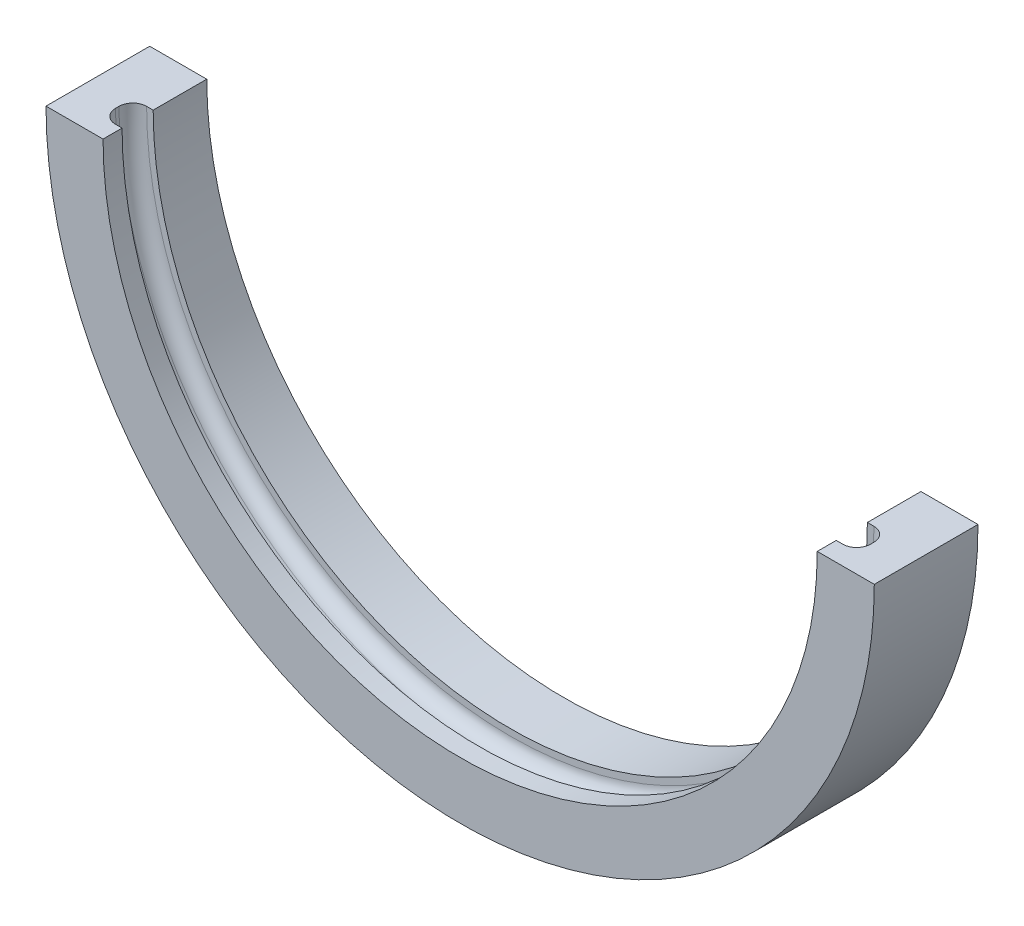
from build123d import *

# Parameters (mm, degrees)
BOSS_EXTRUDE1_DEPTH = 5.715
BOSS_EXTRUDE2_DEPTH = 3.4925
BOSS_EXTRUDE3_START = 9.8425
BOSS_EXTRUDE3_DEPTH = 9.8425
FILLET1_R           = 2.54
SKETCH5_R           = 1.524
CUT_EXTRUDE1_DEPTH  = 6.35


with BuildPart() as part:
    # Sketch1 → Boss-Extrude1 (new body)
    with BuildSketch(Plane.XY):
        with BuildLine():
            ThreePointArc((69.342, 76.073), (0, 6.731), (-69.342, 76.073))
            Line((-69.342, 76.073), (-76.073, 76.073))
            ThreePointArc((-76.073, 76.073), (0, 0), (76.073, 76.073))
            Line((76.073, 76.073), (69.342, 76.073))
        make_face()
    extrude(amount=BOSS_EXTRUDE1_DEPTH)

    # Sketch3 → Boss-Extrude2 (add)
    with BuildSketch(Plane.XY.offset(5.715)):
        with BuildLine():
            ThreePointArc((65.5955, 76.073), (0, 10.4775), (-65.5955, 76.073))
            Line((-65.5955, 76.073), (-76.073, 76.073))
            ThreePointArc((-76.073, 76.073), (0, 0), (76.073, 76.073))
            Line((76.073, 76.073), (65.5955, 76.073))
        make_face()
    extrude(amount=BOSS_EXTRUDE2_DEPTH)

    # Sketch4 → Boss-Extrude3 (add)
    with BuildSketch(Plane(origin=(0, 0, 0), x_dir=(-1, 0, 0), z_dir=(0, 0, -1)).offset(BOSS_EXTRUDE3_START)):
        with BuildLine():
            ThreePointArc((65.5955, 76.073), (0, 10.4775), (-65.5955, 76.073))
            Line((-65.5955, 76.073), (-76.073, 76.073))
            ThreePointArc((-76.073, 76.073), (0, 0), (76.073, 76.073))
            Line((76.073, 76.073), (65.5955, 76.073))
        make_face()
    extrude(amount=-BOSS_EXTRUDE3_DEPTH)

    # Fillet1
    fillet1_edges = [part.edges().sort_by_distance(p)[0] for p in [
        (0, 6.731, 5.715),
        (0, 6.731, 0),
    ]]
    fillet(fillet1_edges, radius=FILLET1_R)

    # Sketch5 → Cut-Extrude1 (cut)
    with BuildSketch(Plane(origin=(0, 0, 0), x_dir=(1, 0, 0), z_dir=(0, 1, 0))):
        with Locations((0, -2.8575)):
            Circle(SKETCH5_R)
    extrude(amount=CUT_EXTRUDE1_DEPTH, mode=Mode.SUBTRACT)


solid = part.part
